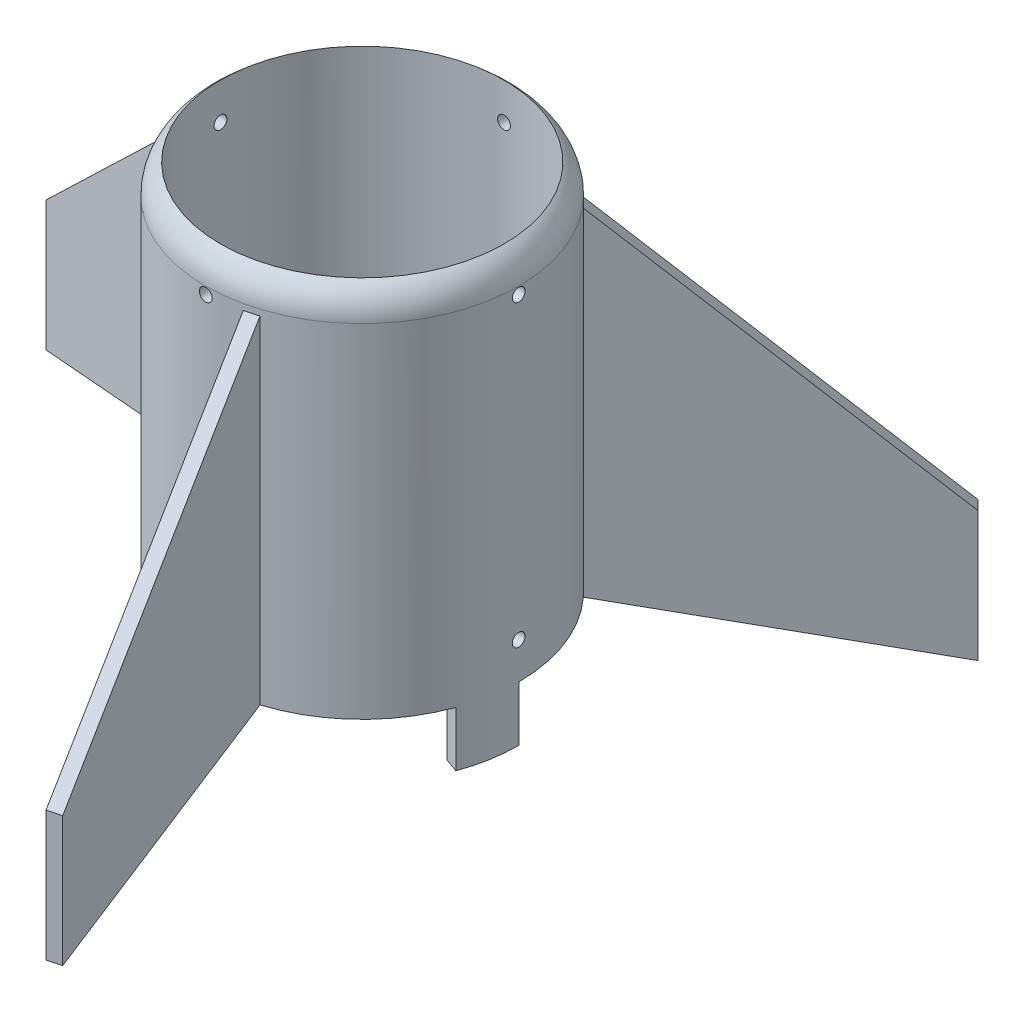
from build123d import *
from build123d.topology import SkipClean

# Parameters (mm, degrees)
SKETCH1_R               = 42.75
SKETCH1_R_2             = 38.75
BOSS_EXTRUDE1_DEPTH     = 101.6
BOSS_EXTRUDE2_START     = 15
BOSS_EXTRUDE2_DEPTH     = 15
CUT_EXTRUDE1_DEPTH      = 119.22725997
CUT_EXTRUDE1_DEPTH_BACK = 119.22725997
SKETCH3_R               = 1.75
CUT_EXTRUDE2_DEPTH      = 119.227260131
CUT_EXTRUDE2_DEPTH_BACK = 119.227260131
SKETCH4_R               = 1.75
FILLET1_R               = 10
BOSS_EXTRUDE3_DEPTH     = 92
CUT_EXTRUDE3_DEPTH      = 158.836643527
BOSS_EXTRUDE4_DEPTH     = 3.72945762
CIRPATTERN2_COUNT       = 3


with BuildPart() as part:
    # Sketch1 → Boss-Extrude1 (new body)
    with BuildSketch(Plane(origin=(0, 0, 0), x_dir=(1, 0, 0), z_dir=(0, 1, 0))):
        with Locations(Location((0, 0, 0), (0, 0, 270))):
            Circle(SKETCH1_R)
        with Locations(Location((0, 0, 0), (0, 0, 270))):
            Circle(SKETCH1_R_2, mode=Mode.SUBTRACT)
    extrude(amount=BOSS_EXTRUDE1_DEPTH)

    # Sketch2 → Boss-Extrude2 (add)
    with SkipClean():  # the faces are left unmerged after this step: merging them gives an invalid solid
        with BuildSketch(Plane.XZ.offset(BOSS_EXTRUDE2_START)):
            with BuildLine():
                Line((40.171859539, 14.621361127), (36.413089055, 13.253280554))
                ThreePointArc((36.413089055, 13.253280554), (38.161300429, 6.728866885), (38.75, 0))
                Line((38.75, 0), (42.75, 0))
                ThreePointArc((42.75, 0), (42.100531441, 7.423459595), (40.171859539, 14.621361127))
            make_face()
            with BuildLine():
                Line((-7.423459595, -42.100531441), (-6.728866885, -38.161300429))
                ThreePointArc((-6.728866885, -38.161300429), (-13.253280554, -36.413089056), (-19.375, -33.558484397))
                Line((-19.375, -33.558484397), (-21.375, -37.022586012))
                ThreePointArc((-21.375, -37.022586012), (-14.621361127, -40.171859539), (-7.423459595, -42.100531441))
            make_face()
            with BuildLine():
                Line((-32.748399943, 27.479170314), (-29.684222171, 24.908019875))
                ThreePointArc((-29.684222171, 24.908019875), (-24.908019875, 29.684222171), (-19.375, 33.558484397))
                Line((-19.375, 33.558484397), (-21.375, 37.022586012))
                ThreePointArc((-21.375, 37.022586012), (-27.479170314, 32.748399943), (-32.748399943, 27.479170314))
            make_face()
        extrude(amount=-BOSS_EXTRUDE2_DEPTH)

    # Sketch3 → Cut-Extrude1 (cut, two sides: drawn at the far end of the back side and taken through both)
    with SkipClean():  # the faces are left unmerged after this step: merging them gives an invalid solid
        with BuildSketch(Plane.XY.offset(-CUT_EXTRUDE1_DEPTH_BACK)):
            with Locations((0, 91.6)):
                Circle(SKETCH3_R)
            with Locations((0, 10)):
                Circle(SKETCH3_R)
        extrude(amount=CUT_EXTRUDE1_DEPTH + CUT_EXTRUDE1_DEPTH_BACK, mode=Mode.SUBTRACT)

    # Sketch4 → Cut-Extrude2 (cut, two sides: drawn at the far end of the back side and taken through both)
    with SkipClean():  # the faces are left unmerged after this step: merging them gives an invalid solid
        with BuildSketch(Plane(origin=(0, 0, 0), x_dir=(0, 0, -1), z_dir=(1, 0, 0)).offset(-CUT_EXTRUDE2_DEPTH_BACK)):
            with Locations((0, 91.6)):
                Circle(SKETCH4_R)
            with Locations((0, 10)):
                Circle(SKETCH4_R)
        extrude(amount=CUT_EXTRUDE2_DEPTH + CUT_EXTRUDE2_DEPTH_BACK, mode=Mode.SUBTRACT)

    # Fillet1
    # the kernel refuses this fillet: 10 mm, written as the material it takes off along each edge
    with BuildSketch(Plane(origin=(0, 101.6, 0), x_dir=(0, 0, 1), z_dir=(-1, 0, 0))) as fillet1_piece_1:
        with BuildLine():
            CenterArc((32.75, -8), FILLET1_R, 0, 53.130102354)
            Line((38.75, 0), (38.87, 0.16))
            ThreePointArc((38.87, 0.16), (40.75, 0.2), (42.75, 0.2))
            Line((42.75, 0.2), (42.95, 0))
            Line((42.95, 0), (42.95, -8))
            Line((42.95, -8), (42.75, -8))
        make_face()
    revolve(axis=Axis((0, 101.6, 0), (0, 1, 0)), mode=Mode.SUBTRACT)

    # Sketch5 → Boss-Extrude3 (add)
    with BuildSketch(Plane.XZ):
        with BuildLine():
            Line((28.881481376, -31.518606149), (82.763018102, -85.400142875))
            Line((82.763018102, -85.400142875), (85.400142875, -82.763018102))
            Line((85.400142875, -82.763018102), (31.518606149, -28.881481376))
            ThreePointArc((31.518606149, -28.881481376), (30.228814896, -30.228814896), (28.881481376, -31.518606149))
        make_face()
    boss_extrude3 = extrude(amount=-BOSS_EXTRUDE3_DEPTH)

    # Sketch6 → Cut-Extrude3 (cut, through all)
    with BuildSketch(Plane(origin=(1.318562387, 0, 1.318562387), x_dir=(0.707106781186549, 0, -0.707106781186546), z_dir=(0.707106781186546, 0, 0.707106781186549))):
        Polygon((42.709311473, 92), (118.909311473, 20.473660557), (118.909311473, 92), align=None)
    cut_extrude3 = extrude(amount=-CUT_EXTRUDE3_DEPTH, mode=Mode.SUBTRACT)

    # Sketch7 → Boss-Extrude4 (add)
    with BuildSketch(Plane(origin=(1.318562387, 0, 1.318562387), x_dir=(0.707106781186549, 0, -0.707106781186546), z_dir=(0.707106781186546, 0, 0.707106781186549))):
        Polygon((42.709311473, 0), (118.909311473, -15), (118.909311473, 20.473660557), align=None)
    boss_extrude4 = extrude(amount=-BOSS_EXTRUDE4_DEPTH)

    # CirPattern2: Boss-Extrude3, Cut-Extrude3, Boss-Extrude4 ×3 about axis
    cirpattern2_axis = Axis((0, 0, 0), (0, 1, 0))
    add([boss_extrude3.rotate(cirpattern2_axis, i * 360 / CIRPATTERN2_COUNT) for i in range(1, CIRPATTERN2_COUNT)])
    add([cut_extrude3.rotate(cirpattern2_axis, i * 360 / CIRPATTERN2_COUNT) for i in range(1, CIRPATTERN2_COUNT)], mode=Mode.SUBTRACT)
    add([boss_extrude4.rotate(cirpattern2_axis, i * 360 / CIRPATTERN2_COUNT) for i in range(1, CIRPATTERN2_COUNT)])


solid = part.part
